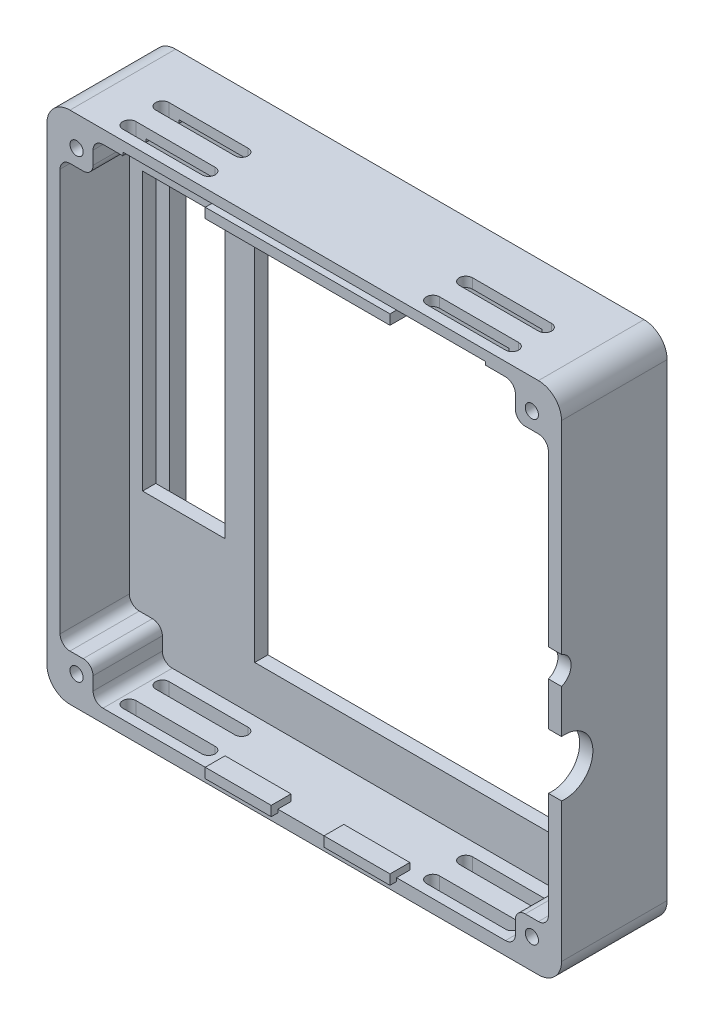
from build123d import *

# Parameters (mm, degrees)
SKETCH_1_W           = 78
SKETCH_1_H           = 78
EXTRUDE_1_DEPTH      = 5.5
SKETCH_2_W           = 78
SKETCH_2_H           = 78
EXTRUDE_2_DEPTH      = 10.5
FILLET_1_R           = 1.5
FILLET_2_R           = 3.5
CUT_EXTRUDE_1_DEPTH  = 1
CUT_EXTRUDE_2_DEPTH  = 2.5
SKETCH_5_R           = 1
CUT_EXTRUDE_3_DEPTH  = 58.15767665
SKETCH_6_W           = 55
SKETCH_6_H           = 2
SKETCH_6_W_2         = 54
SKETCH_6_H_2         = 58
SKETCH_6_W_3         = 12.5
SKETCH_6_H_3         = 42
CUT_EXTRUDE_4_DEPTH  = 57.553072419
EXTRUDE_3_DEPTH      = 1
EXTRUDE_3_DEPTH_BACK = 2
SKETCH_7_W           = 10
SKETCH_7_H           = 1.5
SKETCH_7_W_2         = 28
SKETCH_8_R           = 4.25
SKETCH_8_R_2         = 2.247220505
CUT_EXTRUDE_5_DEPTH  = 10
CUT_EXTRUDE_6_DEPTH  = 89.848185125


with BuildPart() as part:
    # 草图1 → 凸台-拉伸1 (new body)
    with BuildSketch(Plane.XY):
        Rectangle(SKETCH_1_W, SKETCH_1_H)
    extrude(amount=EXTRUDE_1_DEPTH)

    # 草图2 → 凸台-拉伸2 (add)
    with BuildSketch(Plane.XY.offset(5.5)):
        Rectangle(SKETCH_2_W, SKETCH_2_H)
        Polygon((-32, 37), (32, 37), (32, 32), (37, 32), (37, -32), (32, -32), (32, -37), (-32, -37), (-32, -32), (-37, -32), (-37, 32), (-32, 32), align=None, mode=Mode.SUBTRACT)
    extrude(amount=EXTRUDE_2_DEPTH)

    # 圆角1
    fillet_1_edges = [part.edges().sort_by_distance(p)[0] for p in [
        (37, 32, 10.75),
        (32, 32, 10.75),
        (32, 37, 10.75),
        (37, -32, 10.75),
        (32, -32, 10.75),
        (32, -37, 10.75),
        (-32, -37, 10.75),
        (-32, -32, 10.75),
        (-37, -32, 10.75),
        (-37, 32, 10.75),
        (-32, 37, 10.75),
        (-32, 32, 10.75),
    ]]
    fillet(fillet_1_edges, radius=FILLET_1_R)

    # 圆角2
    fillet_2_edges = [part.edges().sort_by_distance(p)[0] for p in [
        (-39, 39, 8),
        (39, 39, 8),
        (39, -39, 8),
        (-39, -39, 8),
    ]]
    fillet(fillet_2_edges, radius=FILLET_2_R)

    # 草图3 → 切除-拉伸1 (cut)
    with BuildSketch(Plane(origin=(0, 0, 0), x_dir=(-1, 0, 0), z_dir=(0, 0, -1))):
        with BuildLine():
            Line((37.5, -35.5), (37.5, 35.5))
            ThreePointArc((37.5, 35.5), (36.914213562, 36.914213562), (35.5, 37.5))
            Line((35.5, 37.5), (-35.5, 37.5))
            ThreePointArc((-35.5, 37.5), (-36.914213562, 36.914213562), (-37.5, 35.5))
            Line((-37.5, 35.5), (-37.5, -35.5))
            ThreePointArc((-37.5, -35.5), (-36.914213562, -36.914213562), (-35.5, -37.5))
            Line((-35.5, -37.5), (35.5, -37.5))
            ThreePointArc((35.5, -37.5), (36.914213562, -36.914213562), (37.5, -35.5))
        make_face()
    extrude(amount=-CUT_EXTRUDE_1_DEPTH, mode=Mode.SUBTRACT)

    # 草图4 → 切除-拉伸2 (cut)
    with BuildSketch(Plane(origin=(0, 0, 1), x_dir=(-1, 0, 0), z_dir=(0, 0, -1))):
        Polygon((27.5, 37.5), (-27.5, 37.5), (-27.5, 36.85), (-32.95, 36.85), (-32.95, -33), (32.95, -33), (32.95, 36.85), (27.5, 36.85), align=None)
    extrude(amount=-CUT_EXTRUDE_2_DEPTH, mode=Mode.SUBTRACT)

    # 草图5 → 切除-拉伸3 (cut, through all)
    with BuildSketch(Plane(origin=(0, 0, 1), x_dir=(-1, 0, 0), z_dir=(0, 0, -1))):
        with Locations((-34.5, 34.5)):
            Circle(SKETCH_5_R)
        with Locations((34.5, 34.5)):
            Circle(SKETCH_5_R)
        with Locations((34.5, -34.5)):
            Circle(SKETCH_5_R)
        with Locations((-34.5, -34.5)):
            Circle(SKETCH_5_R)
    extrude(amount=-CUT_EXTRUDE_3_DEPTH, mode=Mode.SUBTRACT)

    # 草图6 → 切除-拉伸4 (cut, through all)
    with BuildSketch(Plane(origin=(0, 0, 3.5), x_dir=(-1, 0, 0), z_dir=(0, 0, -1))):
        with Locations((0, 36.5)):
            Rectangle(SKETCH_6_W, SKETCH_6_H)
        with Locations((-9, -1)):
            Rectangle(SKETCH_6_W_2, SKETCH_6_H_2)
        with Locations((28.75, 5)):
            Rectangle(SKETCH_6_W_3, SKETCH_6_H_3)
    extrude(amount=-CUT_EXTRUDE_4_DEPTH, mode=Mode.SUBTRACT)

    # 草图7 → 凸台-拉伸3 (add, two sides: drawn at the far end of the back side and taken through both)
    with BuildSketch(Plane.XY.offset(16).offset(-EXTRUDE_3_DEPTH_BACK)):
        with Locations((9, -36.75)):
            Rectangle(SKETCH_7_W, SKETCH_7_H)
        with Locations((-9, -36.75)):
            Rectangle(SKETCH_7_W, SKETCH_7_H)
        with Locations((0, 36.75)):
            Rectangle(SKETCH_7_W_2, SKETCH_7_H)
    extrude(amount=EXTRUDE_3_DEPTH + EXTRUDE_3_DEPTH_BACK)

    # 草图8 → 切除-拉伸5 (cut)
    with BuildSketch(Plane(origin=(39, 0, 0), x_dir=(0, 0, -1), z_dir=(1, 0, 0))):
        with Locations((-15.5, -10.2)):
            Circle(SKETCH_8_R)
        with Locations((-16.8, 2.7)):
            Circle(SKETCH_8_R_2)
    extrude(amount=-CUT_EXTRUDE_5_DEPTH, mode=Mode.SUBTRACT)

    # 草图9 → 切除-拉伸6 (cut, through all)
    with BuildSketch(Plane.XZ.offset(39)):
        with BuildLine():
            Line((-29, 14.5), (-17, 14.5))
            ThreePointArc((-17, 14.5), (-16, 13.5), (-17, 12.5))
            Line((-17, 12.5), (-29, 12.5))
            ThreePointArc((-29, 12.5), (-30, 13.5), (-29, 14.5))
        make_face()
        with BuildLine():
            Line((-29, 9.5), (-17, 9.5))
            ThreePointArc((-17, 9.5), (-16, 8.5), (-17, 7.5))
            Line((-17, 7.5), (-29, 7.5))
            ThreePointArc((-29, 7.5), (-30, 8.5), (-29, 9.5))
        make_face()
        with BuildLine():
            Line((29, 9.5), (17, 9.5))
            ThreePointArc((17, 9.5), (16, 8.5), (17, 7.5))
            Line((17, 7.5), (29, 7.5))
            ThreePointArc((29, 7.5), (30, 8.5), (29, 9.5))
        make_face()
        with BuildLine():
            Line((29, 14.5), (17, 14.5))
            ThreePointArc((17, 14.5), (16, 13.5), (17, 12.5))
            Line((17, 12.5), (29, 12.5))
            ThreePointArc((29, 12.5), (30, 13.5), (29, 14.5))
        make_face()
    extrude(amount=-CUT_EXTRUDE_6_DEPTH, mode=Mode.SUBTRACT)


solid = part.part
